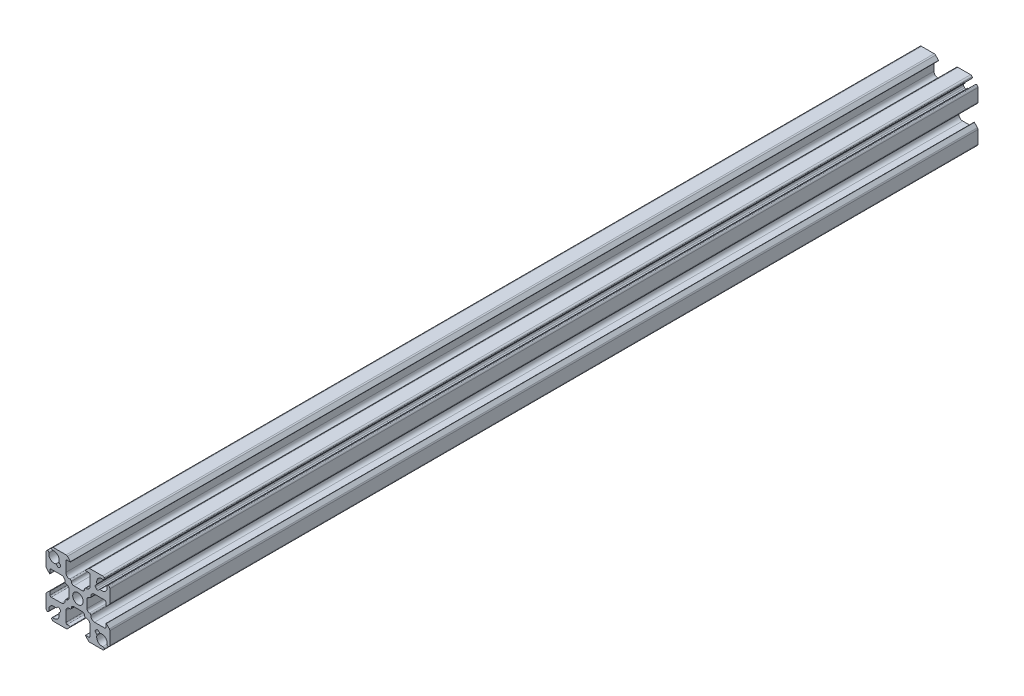
from build123d import *

# Parameters (mm, degrees)
SKETCH1_R                            = 2.08
BOSS_EXTRUDE1_DEPTH                  = 172.5549
SKETCH2_W                            = 2.5
SKETCH2_H                            = 16.3
TAP_DRILL_FOR_M6X1_0_TAP2_AT_2_COUNT = 2
TAP_DRILL_FOR_M6X1_0_TAP2_AT_2_PITCH = 120
TAP_DRILL_FOR_M6X1_0_TAP2_AT_3_COUNT = 2
TAP_DRILL_FOR_M6X1_0_TAP2_AT_3_PITCH = 240
SKETCH4_W                            = 2.5
SKETCH4_H                            = 16.3
TAP_DRILL_FOR_M6X1_0_TAP1_AT_2_COUNT = 2
TAP_DRILL_FOR_M6X1_0_TAP1_AT_2_PITCH = 120
TAP_DRILL_FOR_M6X1_0_TAP1_AT_3_COUNT = 2
TAP_DRILL_FOR_M6X1_0_TAP1_AT_3_PITCH = 240


with BuildPart() as part:
    # Sketch1 → Boss-Extrude1 (new, symmetric)
    with BuildSketch(Plane(origin=(0, 0, 0), x_dir=(-1, 0, 0), z_dir=(0, 0, -1))):
        with BuildLine():
            Line((-7.48853247, 8.61990332), (-6.985643798, 8.117014648))
            ThreePointArc((-6.985643798, 8.117014648), (-6.839197188, 7.763461257), (-6.985643798, 7.409907866))
            Line((-6.985643798, 7.409907866), (-7.409907866, 6.985643798))
            ThreePointArc((-7.409907866, 6.985643798), (-7.763461257, 6.839197188), (-8.117014648, 6.985643798))
            Line((-8.117014648, 6.985643798), (-8.61990332, 7.48853247))
            ThreePointArc((-8.61990332, 7.48853247), (-8.738774884, 7.554957329), (-8.874825936, 7.549228331))
            ThreePointArc((-8.874825936, 7.549228331), (-10.889377278, 7.955008076), (-11.572136222, 9.893284252))
            ThreePointArc((-11.572136222, 9.893284252), (-11.766795458, 10.383720777), (-12.292708824, 10.42656157))
            ThreePointArc((-12.292708824, 10.42656157), (-12.590129525, 10.150252615), (-12.7, 9.759440396))
            Line((-12.7, 9.759440396), (-12.7, 4.710660172))
            ThreePointArc((-12.7, 4.710660172), (-12.642909649, 4.423647598), (-12.480330086, 4.180330086))
            Line((-12.480330086, 4.180330086), (-11.270710678, 2.970710678))
            ThreePointArc((-11.270710678, 2.970710678), (-11.161731657, 2.949033403), (-11.1, 3.041421356))
            Line((-11.1, 3.041421356), (-11.1, 4.325))
            ThreePointArc((-11.1, 4.325), (-10.953553391, 4.678553391), (-10.6, 4.825))
            Line((-10.6, 4.825), (-6.6, 4.825))
            ThreePointArc((-6.6, 4.825), (-5.539339828, 4.385660172), (-5.1, 3.325))
            Line((-5.1, 3.325), (-5.1, 3.15))
            ThreePointArc((-5.1, 3.15), (-4.953553391, 2.796446609), (-4.6, 2.65))
            ThreePointArc((-4.6, 2.65), (-3.892893219, 2.357106781), (-3.6, 1.65))
            Line((-3.6, 1.65), (-3.6, -1.65))
            ThreePointArc((-3.6, -1.65), (-3.892893219, -2.357106781), (-4.6, -2.65))
            ThreePointArc((-4.6, -2.65), (-4.953553391, -2.796446609), (-5.1, -3.15))
            Line((-5.1, -3.15), (-5.1, -3.325))
            ThreePointArc((-5.1, -3.325), (-5.539339828, -4.385660172), (-6.6, -4.825))
            Line((-6.6, -4.825), (-10.6, -4.825))
            ThreePointArc((-10.6, -4.825), (-10.953553391, -4.678553391), (-11.1, -4.325))
            Line((-11.1, -4.325), (-11.1, -3.041421356))
            ThreePointArc((-11.1, -3.041421356), (-11.161731657, -2.949033403), (-11.270710678, -2.970710678))
            Line((-11.270710678, -2.970710678), (-12.480330086, -4.180330086))
            ThreePointArc((-12.480330086, -4.180330086), (-12.642909649, -4.423647598), (-12.7, -4.710660172))
            Line((-12.7, -4.710660172), (-12.7, -9.759440396))
            ThreePointArc((-12.7, -9.759440396), (-12.590129525, -10.150252615), (-12.292708824, -10.42656157))
            ThreePointArc((-12.292708824, -10.42656157), (-11.766795458, -10.383720777), (-11.572136222, -9.893284252))
            ThreePointArc((-11.572136222, -9.893284252), (-10.889377278, -7.955008076), (-8.874825936, -7.549228331))
            ThreePointArc((-8.874825936, -7.549228331), (-8.738774884, -7.554957329), (-8.61990332, -7.48853247))
            Line((-8.61990332, -7.48853247), (-8.117014648, -6.985643798))
            ThreePointArc((-8.117014648, -6.985643798), (-7.763461257, -6.839197188), (-7.409907866, -6.985643798))
            Line((-7.409907866, -6.985643798), (-6.985643798, -7.409907866))
            ThreePointArc((-6.985643798, -7.409907866), (-6.839197188, -7.763461257), (-6.985643798, -8.117014648))
            Line((-6.985643798, -8.117014648), (-7.48853247, -8.61990332))
            ThreePointArc((-7.48853247, -8.61990332), (-7.554957329, -8.738774884), (-7.549228331, -8.874825936))
            ThreePointArc((-7.549228331, -8.874825936), (-7.955008076, -10.889377278), (-9.893284252, -11.572136222))
            ThreePointArc((-9.893284252, -11.572136222), (-10.383720777, -11.766795458), (-10.42656157, -12.292708824))
            ThreePointArc((-10.42656157, -12.292708824), (-10.150252615, -12.590129525), (-9.759440396, -12.7))
            Line((-9.759440396, -12.7), (-4.710660172, -12.7))
            ThreePointArc((-4.710660172, -12.7), (-4.423647598, -12.642909649), (-4.180330086, -12.480330086))
            Line((-4.180330086, -12.480330086), (-2.970710678, -11.270710678))
            ThreePointArc((-2.970710678, -11.270710678), (-2.949033403, -11.161731657), (-3.041421356, -11.1))
            Line((-3.041421356, -11.1), (-4.325, -11.1))
            ThreePointArc((-4.325, -11.1), (-4.678553391, -10.953553391), (-4.825, -10.6))
            Line((-4.825, -10.6), (-4.825, -6.6))
            ThreePointArc((-4.825, -6.6), (-4.385660172, -5.539339828), (-3.325, -5.1))
            Line((-3.325, -5.1), (-3.15, -5.1))
            ThreePointArc((-3.15, -5.1), (-2.796446609, -4.953553391), (-2.65, -4.6))
            ThreePointArc((-2.65, -4.6), (-2.357106781, -3.892893219), (-1.65, -3.6))
            Line((-1.65, -3.6), (1.65, -3.6))
            ThreePointArc((1.65, -3.6), (2.357106781, -3.892893219), (2.65, -4.6))
            ThreePointArc((2.65, -4.6), (2.796446609, -4.953553391), (3.15, -5.1))
            Line((3.15, -5.1), (3.325, -5.1))
            ThreePointArc((3.325, -5.1), (4.385660172, -5.539339828), (4.825, -6.6))
            Line((4.825, -6.6), (4.825, -10.6))
            ThreePointArc((4.825, -10.6), (4.678553391, -10.953553391), (4.325, -11.1))
            Line((4.325, -11.1), (3.041421356, -11.1))
            ThreePointArc((3.041421356, -11.1), (2.949033403, -11.161731657), (2.970710678, -11.270710678))
            Line((2.970710678, -11.270710678), (4.180330086, -12.480330086))
            ThreePointArc((4.180330086, -12.480330086), (4.423647598, -12.642909649), (4.710660172, -12.7))
            Line((4.710660172, -12.7), (9.759440396, -12.7))
            ThreePointArc((9.759440396, -12.7), (10.150252615, -12.590129525), (10.42656157, -12.292708824))
            ThreePointArc((10.42656157, -12.292708824), (10.383720777, -11.766795458), (9.893284252, -11.572136222))
            ThreePointArc((9.893284252, -11.572136222), (7.955008076, -10.889377278), (7.549228331, -8.874825936))
            ThreePointArc((7.549228331, -8.874825936), (7.554957329, -8.738774884), (7.48853247, -8.61990332))
            Line((7.48853247, -8.61990332), (6.985643798, -8.117014648))
            ThreePointArc((6.985643798, -8.117014648), (6.839197188, -7.763461257), (6.985643798, -7.409907866))
            Line((6.985643798, -7.409907866), (7.409907866, -6.985643798))
            ThreePointArc((7.409907866, -6.985643798), (7.763461257, -6.839197188), (8.117014648, -6.985643798))
            Line((8.117014648, -6.985643798), (8.61990332, -7.48853247))
            ThreePointArc((8.61990332, -7.48853247), (8.738774884, -7.554957329), (8.874825936, -7.549228331))
            ThreePointArc((8.874825936, -7.549228331), (10.889377278, -7.955008076), (11.572136222, -9.893284252))
            ThreePointArc((11.572136222, -9.893284252), (11.766795458, -10.383720777), (12.292708824, -10.42656157))
            ThreePointArc((12.292708824, -10.42656157), (12.590129525, -10.150252615), (12.7, -9.759440396))
            Line((12.7, -9.759440396), (12.7, -4.710660172))
            ThreePointArc((12.7, -4.710660172), (12.642909649, -4.423647598), (12.480330086, -4.180330086))
            Line((12.480330086, -4.180330086), (11.270710678, -2.970710678))
            ThreePointArc((11.270710678, -2.970710678), (11.161731657, -2.949033403), (11.1, -3.041421356))
            Line((11.1, -3.041421356), (11.1, -4.325))
            ThreePointArc((11.1, -4.325), (10.953553391, -4.678553391), (10.6, -4.825))
            Line((10.6, -4.825), (6.6, -4.825))
            ThreePointArc((6.6, -4.825), (5.539339828, -4.385660172), (5.1, -3.325))
            Line((5.1, -3.325), (5.1, -3.15))
            ThreePointArc((5.1, -3.15), (4.953553391, -2.796446609), (4.6, -2.65))
            ThreePointArc((4.6, -2.65), (3.892893219, -2.357106781), (3.6, -1.65))
            Line((3.6, -1.65), (3.6, 1.65))
            ThreePointArc((3.6, 1.65), (3.892893219, 2.357106781), (4.6, 2.65))
            ThreePointArc((4.6, 2.65), (4.953553391, 2.796446609), (5.1, 3.15))
            Line((5.1, 3.15), (5.1, 3.325))
            ThreePointArc((5.1, 3.325), (5.539339828, 4.385660172), (6.6, 4.825))
            Line((6.6, 4.825), (10.6, 4.825))
            ThreePointArc((10.6, 4.825), (10.953553391, 4.678553391), (11.1, 4.325))
            Line((11.1, 4.325), (11.1, 3.041421356))
            ThreePointArc((11.1, 3.041421356), (11.161731657, 2.949033403), (11.270710678, 2.970710678))
            Line((11.270710678, 2.970710678), (12.480330086, 4.180330086))
            ThreePointArc((12.480330086, 4.180330086), (12.642909649, 4.423647598), (12.7, 4.710660172))
            Line((12.7, 4.710660172), (12.7, 9.759440396))
            ThreePointArc((12.7, 9.759440396), (12.590129525, 10.150252615), (12.292708824, 10.42656157))
            ThreePointArc((12.292708824, 10.42656157), (11.766795458, 10.383720777), (11.572136222, 9.893284252))
            ThreePointArc((11.572136222, 9.893284252), (10.889377278, 7.955008076), (8.874825936, 7.549228331))
            ThreePointArc((8.874825936, 7.549228331), (8.738774884, 7.554957329), (8.61990332, 7.48853247))
            Line((8.61990332, 7.48853247), (8.117014648, 6.985643798))
            ThreePointArc((8.117014648, 6.985643798), (7.763461257, 6.839197188), (7.409907866, 6.985643798))
            Line((7.409907866, 6.985643798), (6.985643798, 7.409907866))
            ThreePointArc((6.985643798, 7.409907866), (6.839197188, 7.763461257), (6.985643798, 8.117014648))
            Line((6.985643798, 8.117014648), (7.48853247, 8.61990332))
            ThreePointArc((7.48853247, 8.61990332), (7.554957329, 8.738774884), (7.549228331, 8.874825936))
            ThreePointArc((7.549228331, 8.874825936), (7.955008076, 10.889377278), (9.893284252, 11.572136222))
            ThreePointArc((9.893284252, 11.572136222), (10.383720777, 11.766795458), (10.42656157, 12.292708824))
            ThreePointArc((10.42656157, 12.292708824), (10.150252615, 12.590129525), (9.759440396, 12.7))
            Line((9.759440396, 12.7), (4.710660172, 12.7))
            ThreePointArc((4.710660172, 12.7), (4.423647598, 12.642909649), (4.180330086, 12.480330086))
            Line((4.180330086, 12.480330086), (2.970710678, 11.270710678))
            ThreePointArc((2.970710678, 11.270710678), (2.949033403, 11.161731657), (3.041421356, 11.1))
            Line((3.041421356, 11.1), (4.325, 11.1))
            ThreePointArc((4.325, 11.1), (4.678553391, 10.953553391), (4.825, 10.6))
            Line((4.825, 10.6), (4.825, 6.6))
            ThreePointArc((4.825, 6.6), (4.385660172, 5.539339828), (3.325, 5.1))
            Line((3.325, 5.1), (3.15, 5.1))
            ThreePointArc((3.15, 5.1), (2.796446609, 4.953553391), (2.65, 4.6))
            ThreePointArc((2.65, 4.6), (2.357106781, 3.892893219), (1.65, 3.6))
            Line((1.65, 3.6), (-1.65, 3.6))
            ThreePointArc((-1.65, 3.6), (-2.357106781, 3.892893219), (-2.65, 4.6))
            ThreePointArc((-2.65, 4.6), (-2.796446609, 4.953553391), (-3.15, 5.1))
            Line((-3.15, 5.1), (-3.325, 5.1))
            ThreePointArc((-3.325, 5.1), (-4.385660172, 5.539339828), (-4.825, 6.6))
            Line((-4.825, 6.6), (-4.825, 10.6))
            ThreePointArc((-4.825, 10.6), (-4.678553391, 10.953553391), (-4.325, 11.1))
            Line((-4.325, 11.1), (-3.041421356, 11.1))
            ThreePointArc((-3.041421356, 11.1), (-2.949033403, 11.161731657), (-2.970710678, 11.270710678))
            Line((-2.970710678, 11.270710678), (-4.180330086, 12.480330086))
            ThreePointArc((-4.180330086, 12.480330086), (-4.423647598, 12.642909649), (-4.710660172, 12.7))
            Line((-4.710660172, 12.7), (-9.759440396, 12.7))
            ThreePointArc((-9.759440396, 12.7), (-10.150252615, 12.590129525), (-10.42656157, 12.292708824))
            ThreePointArc((-10.42656157, 12.292708824), (-10.383720777, 11.766795458), (-9.893284252, 11.572136222))
            ThreePointArc((-9.893284252, 11.572136222), (-7.955008076, 10.889377278), (-7.549228331, 8.874825936))
            ThreePointArc((-7.549228331, 8.874825936), (-7.554957329, 8.738774884), (-7.48853247, 8.61990332))
        make_face()
        Circle(SKETCH1_R, mode=Mode.SUBTRACT)
    extrude(amount=BOSS_EXTRUDE1_DEPTH, both=True)

    # Sketch2 → Tap Drill for M6x1.0 Tap2 (revolve, cut)
    with BuildSketch(Plane(origin=(3.6, 0, 132.55489999), x_dir=(0, 0, -1), z_dir=(0, 1, 0))):
        with Locations((1.25, 8.15)):
            Rectangle(SKETCH2_W, SKETCH2_H)
    tap_drill_for_m6x1_0_tap2 = revolve(axis=Axis((9.95, 0, 132.55489999), (-1, 0, 0)), mode=Mode.SUBTRACT)

    # Tap Drill for M6x1.0 Tap2 at 2: Tap Drill for M6x1.0 Tap2 ×2
    with Locations(*[(0, 0, -i * TAP_DRILL_FOR_M6X1_0_TAP2_AT_2_PITCH) for i in range(1, TAP_DRILL_FOR_M6X1_0_TAP2_AT_2_COUNT)]):
        add(tap_drill_for_m6x1_0_tap2, mode=Mode.SUBTRACT)

    # Tap Drill for M6x1.0 Tap2 at 3: Tap Drill for M6x1.0 Tap2 ×2
    with Locations(*[(0, 0, -i * TAP_DRILL_FOR_M6X1_0_TAP2_AT_3_PITCH) for i in range(1, TAP_DRILL_FOR_M6X1_0_TAP2_AT_3_COUNT)]):
        add(tap_drill_for_m6x1_0_tap2, mode=Mode.SUBTRACT)

    # Sketch4 → Tap Drill for M6x1.0 Tap1 (revolve, cut)
    with BuildSketch(Plane(origin=(-3.6, 0, 151.60489999), x_dir=(0, 0, 1), z_dir=(0, 1, 0))):
        with Locations((1.25, 8.15)):
            Rectangle(SKETCH4_W, SKETCH4_H)
    tap_drill_for_m6x1_0_tap1 = revolve(axis=Axis((-9.95, 0, 151.60489999), (1, 0, 0)), mode=Mode.SUBTRACT)

    # Tap Drill for M6x1.0 Tap1 at 2: Tap Drill for M6x1.0 Tap1 ×2
    with Locations(*[(0, 0, -i * TAP_DRILL_FOR_M6X1_0_TAP1_AT_2_PITCH) for i in range(1, TAP_DRILL_FOR_M6X1_0_TAP1_AT_2_COUNT)]):
        add(tap_drill_for_m6x1_0_tap1, mode=Mode.SUBTRACT)

    # Tap Drill for M6x1.0 Tap1 at 3: Tap Drill for M6x1.0 Tap1 ×2
    with Locations(*[(0, 0, -i * TAP_DRILL_FOR_M6X1_0_TAP1_AT_3_PITCH) for i in range(1, TAP_DRILL_FOR_M6X1_0_TAP1_AT_3_COUNT)]):
        add(tap_drill_for_m6x1_0_tap1, mode=Mode.SUBTRACT)


solid = part.part
